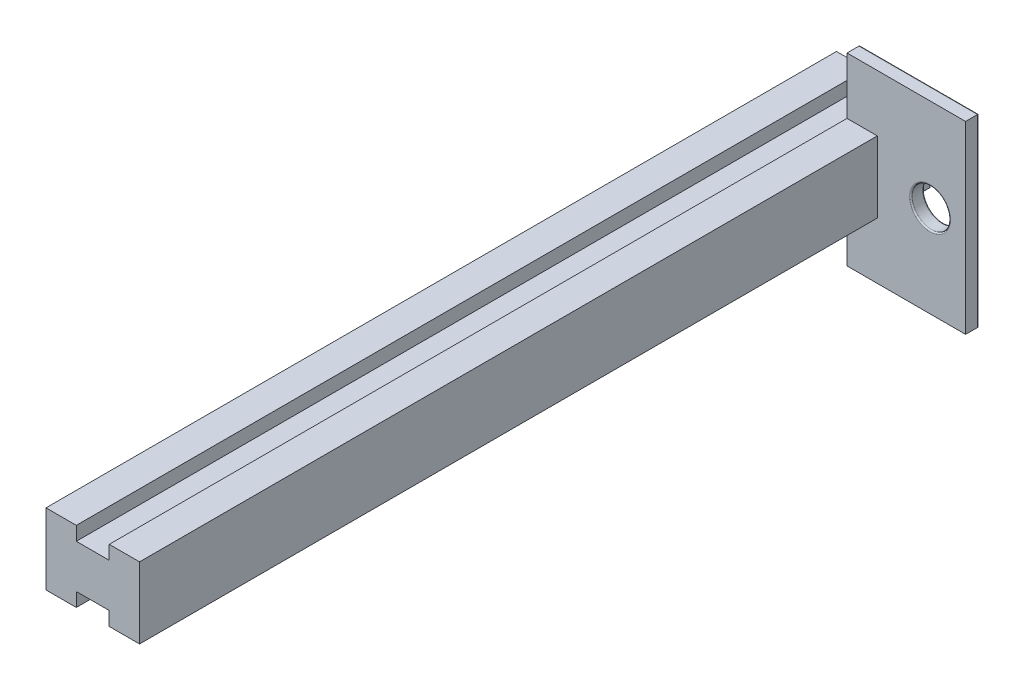
from build123d import *

# Parameters (mm, degrees)
BOSS_EXTRUDE1_DEPTH = 60
SKETCH2_W           = 2.3
SKETCH2_H           = 1
CUT_EXTRUDE1_DEPTH  = 10
SKETCH3_W           = 1
SKETCH3_H           = 14
BOSS_EXTRUDE2_DEPTH = 9
SKETCH4_R           = 1.45
CUT_EXTRUDE2_DEPTH  = 9
FILLET1_R           = 0.1


with BuildPart() as part:
    # Sketch1 → Boss-Extrude1 (new body)
    with BuildSketch(Plane.XY):
        Polygon((-1.3, 2.75), (-3.6, 2.75), (-3.6, -2.65), (-1.3, -2.65), (-1.3, -1.6), (1.2, -1.6), (1.2, -2.65), (3.5, -2.65), (3.5, 2.75), (1.2, 2.75), (1.2, 1.7), (-1.3, 1.7), align=None)
    extrude(amount=BOSS_EXTRUDE1_DEPTH)

    # Sketch2 → Cut-Extrude1 (cut)
    with BuildSketch(Plane(origin=(0, 2.75, 0), x_dir=(1, 0, 0), z_dir=(0, 1, 0))):
        with Locations((2.35, -3.5)):
            Rectangle(SKETCH2_W, SKETCH2_H)
    extrude(amount=-CUT_EXTRUDE1_DEPTH, mode=Mode.SUBTRACT)

    # Sketch3 → Boss-Extrude2 (add)
    with BuildSketch(Plane(origin=(1.2, 0, 0), x_dir=(0, 0, -1), z_dir=(1, 0, 0))):
        with Locations((-3.5, 0.05)):
            Rectangle(SKETCH3_W, SKETCH3_H)
    extrude(amount=BOSS_EXTRUDE2_DEPTH)

    # Sketch4 → Cut-Extrude2 (cut)
    with BuildSketch(Plane(origin=(0, 0, 3), x_dir=(-1, 0, 0), z_dir=(0, 0, -1))):
        with Locations((-7.5, 0)):
            Circle(SKETCH4_R)
    extrude(amount=-CUT_EXTRUDE2_DEPTH, mode=Mode.SUBTRACT)

    # Fillet1
    fillet1_edges = [part.edges().sort_by_distance(p)[0] for p in [
        (1.2, -2.65, 1.5),
        (1.2, 2.75, 1.5),
        (3.5, 0.05, 3),
        (2.35, -2.65, 3),
        (5.7, -6.95, 3),
        (1.2, -4.8, 3),
        (2.35, 2.75, 3),
        (1.2, 4.9, 3),
        (5.7, 7.05, 3),
        (10.2, 0.05, 3),
        (8.95, 0, 4),
        (8.95, 0, 3),
    ]]
    fillet(fillet1_edges, radius=FILLET1_R)


solid = part.part
